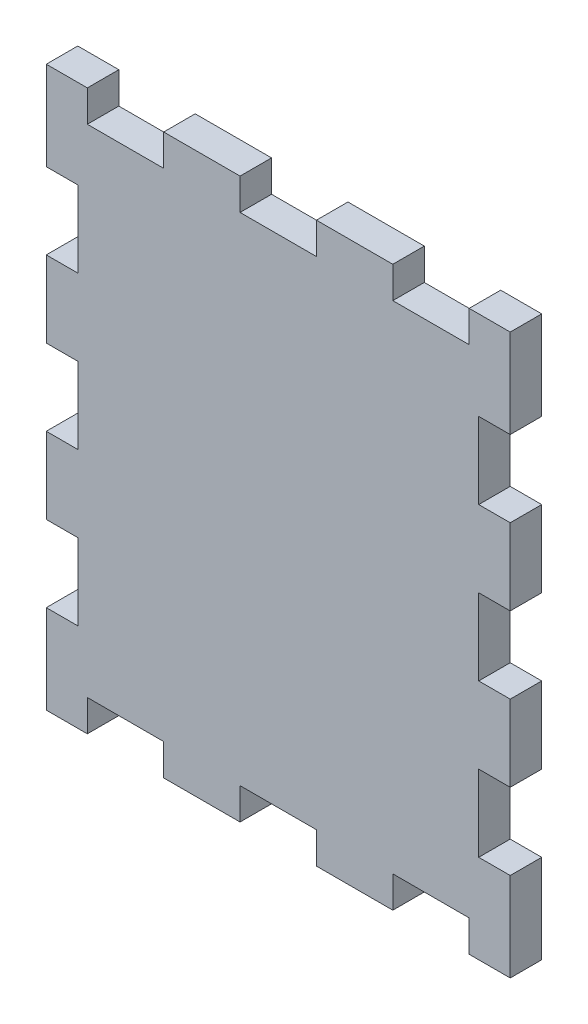
from build123d import *

# Parameters (mm, degrees)
ESQUISSE1_W                    = 42
ESQUISSE1_H                    = 52
BOSS_EXTRU_1_DEPTH             = 3.3
ESQUISSE3_W                    = 3.3
ESQUISSE3_H                    = 8
BOSS_EXTRU_2_DEPTH             = 3.3
R_P_TITION_LIN_AIRE1_COUNT     = 3
R_P_TITION_LIN_AIRE1_PITCH     = 16
R_P_TITION_LIN_AIRE1_COL_COUNT = 2
R_P_TITION_LIN_AIRE1_COL_PITCH = 16
SYM_TRIE1_COPY_1_SKETCH_W      = 3.3
SYM_TRIE1_COPY_1_SKETCH_H      = 8
SYM_TRIE1_COPY_1_DEPTH         = 3.3
SYM_TRIE1_COPY_2_SKETCH_W      = 3.3
SYM_TRIE1_COPY_2_SKETCH_H      = 8
SYM_TRIE1_COPY_2_DEPTH         = 3.3
SYM_TRIE1_COPY_3_SKETCH_W      = 3.3
SYM_TRIE1_COPY_3_SKETCH_H      = 8
SYM_TRIE1_COPY_3_DEPTH         = 3.3
ESQUISSE4_W                    = 8
ESQUISSE4_H                    = 3.3
BOSS_EXTRU_3_DEPTH             = 3.3
R_P_TITION_LIN_AIRE2_COUNT     = 3
R_P_TITION_LIN_AIRE2_PITCH     = 16
R_P_TITION_LIN_AIRE2_COL_COUNT = 2
R_P_TITION_LIN_AIRE2_COL_PITCH = 16
ESQUISSE5_W                    = 3.7
ESQUISSE5_H                    = 3.3
ENL_V_MAT_EXTRU_1_DEPTH        = 41.661775662
SYM_TRIE2_START                = -29.3
SYM_TRIE2_OUTLINE_W            = 4.3
SYM_TRIE2_OUTLINE_H            = 3.3
SYM_TRIE2_OUTLINE_W_2          = 8
SYM_TRIE2_DEPTH                = 3.3


# Read off the part's stored shape, not the designer's step: Symétrie2
with BuildPart() as part:
    # Esquisse1 → Boss.-Extru.1 (new body)
    with BuildSketch(Plane.XY):
        Rectangle(ESQUISSE1_W, ESQUISSE1_H)
    extrude(amount=BOSS_EXTRU_1_DEPTH)

    # Esquisse3 → Boss.-Extru.2 (add)
    with BuildSketch(Plane.XY.offset(3.3)):
        with Locations((22.65, -8)):
            Rectangle(ESQUISSE3_W, ESQUISSE3_H)
    boss_extru_2 = extrude(amount=-BOSS_EXTRU_2_DEPTH)

    # Répétition linéaire1: Boss.-Extru.2 ×3
    with Locations(*[(0, i * R_P_TITION_LIN_AIRE1_PITCH, 0) for i in range(1, R_P_TITION_LIN_AIRE1_COUNT)]):
        add(boss_extru_2)

    # Répétition linéaire1 col: Boss.-Extru.2 ×2
    with Locations(*[(0, -i * R_P_TITION_LIN_AIRE1_COL_PITCH, 0) for i in range(1, R_P_TITION_LIN_AIRE1_COL_COUNT)]):
        add(boss_extru_2)

    # Symétrie1: Boss.-Extru.2 across plane
    add(boss_extru_2.mirror(Plane(origin=(0, 0, 0), x_dir=(0, 0, 1), z_dir=(1, 0, 0))))

    # Symétrie1 copy 1 sketch → Symétrie1 copy 1 (add)
    with BuildSketch(Plane(origin=(0, 16, 3.3), x_dir=(-1, 0, 0), z_dir=(0, 0, 1))):
        with Locations((22.65, 8)):
            Rectangle(SYM_TRIE1_COPY_1_SKETCH_W, SYM_TRIE1_COPY_1_SKETCH_H)
    extrude(amount=-SYM_TRIE1_COPY_1_DEPTH)

    # Symétrie1 copy 2 sketch → Symétrie1 copy 2 (add)
    with BuildSketch(Plane(origin=(0, 32, 3.3), x_dir=(-1, 0, 0), z_dir=(0, 0, 1))):
        with Locations((22.65, 8)):
            Rectangle(SYM_TRIE1_COPY_2_SKETCH_W, SYM_TRIE1_COPY_2_SKETCH_H)
    extrude(amount=-SYM_TRIE1_COPY_2_DEPTH)

    # Symétrie1 copy 3 sketch → Symétrie1 copy 3 (add)
    with BuildSketch(Plane(origin=(0, -16, 3.3), x_dir=(-1, 0, 0), z_dir=(0, 0, 1))):
        with Locations((22.65, 8)):
            Rectangle(SYM_TRIE1_COPY_3_SKETCH_W, SYM_TRIE1_COPY_3_SKETCH_H)
    extrude(amount=-SYM_TRIE1_COPY_3_DEPTH)

    # Esquisse4 → Boss.-Extru.3 (add)
    with BuildSketch(Plane.XY.offset(3.3)):
        with Locations((-8, 27.65)):
            Rectangle(ESQUISSE4_W, ESQUISSE4_H)
    boss_extru_3 = extrude(amount=-BOSS_EXTRU_3_DEPTH)

    # Répétition linéaire2: Boss.-Extru.3 ×3
    with Locations(*[(i * R_P_TITION_LIN_AIRE2_PITCH, 0, 0) for i in range(1, R_P_TITION_LIN_AIRE2_COUNT)]):
        add(boss_extru_3)

    # Répétition linéaire2 col: Boss.-Extru.3 ×2
    with Locations(*[(-i * R_P_TITION_LIN_AIRE2_COL_PITCH, 0, 0) for i in range(1, R_P_TITION_LIN_AIRE2_COL_COUNT)]):
        add(boss_extru_3)

    # Esquisse5 → Enlèv. mat.-Extru.1 (cut, symmetric)
    with BuildSketch(Plane.XY.offset(3.3)):
        with Locations((-26.15, 27.65)):
            Rectangle(ESQUISSE5_W, ESQUISSE5_H)
        with Locations((26.15, 27.65)):
            Rectangle(ESQUISSE5_W, ESQUISSE5_H)
    extrude(amount=ENL_V_MAT_EXTRU_1_DEPTH, both=True, mode=Mode.SUBTRACT)

    # Symétrie2 outline → Symétrie2 (add)
    with BuildSketch(Plane(origin=(0, 0, 0), x_dir=(1, 0, 0), z_dir=(0, 1, 0)).offset(SYM_TRIE2_START)):
        with Locations((22.15, -1.65)):
            Rectangle(SYM_TRIE2_OUTLINE_W, SYM_TRIE2_OUTLINE_H)
        with Locations((8, -1.65)):
            Rectangle(SYM_TRIE2_OUTLINE_W_2, SYM_TRIE2_OUTLINE_H)
        with Locations((-8, -1.65)):
            Rectangle(SYM_TRIE2_OUTLINE_W_2, SYM_TRIE2_OUTLINE_H)
        with Locations((-22.15, -1.65)):
            Rectangle(SYM_TRIE2_OUTLINE_W, SYM_TRIE2_OUTLINE_H)
    extrude(amount=SYM_TRIE2_DEPTH)


solid = part.part
